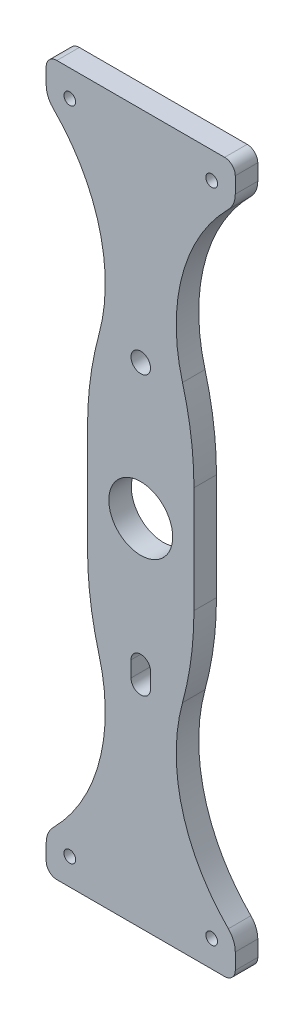
from build123d import *

# Parameters (mm, degrees)
SKETCH1_R           = 9
SKETCH1_R_2         = 2.75
SKETCH1_R_3         = 1.65
BOSS_EXTRUDE1_DEPTH = 6.35


with BuildPart() as part:
    # Sketch1 → Boss-Extrude1 (new body)
    with BuildSketch(Plane.XY):
        with BuildLine():
            Line((-15, 15), (-15, -15))
            ThreePointArc((-15, -15), (-14.189358833, -27.149936386), (-11.771805737, -39.084488338))
            ThreePointArc((-11.771805737, -39.084488338), (-11.680110458, -65.181584812), (-24.702260095, -87.797739905))
            ThreePointArc((-24.702260095, -87.797739905), (-26.143798891, -89.955155175), (-26.65, -92.5))
            Line((-26.65, -92.5), (-26.65, -97))
            ThreePointArc((-26.65, -97), (-25.771320344, -99.121320344), (-23.65, -100))
            Line((-23.65, -100), (23.65, -100))
            ThreePointArc((23.65, -100), (25.771320344, -99.121320344), (26.65, -97))
            Line((26.65, -97), (26.65, -92.5))
            ThreePointArc((26.65, -92.5), (26.143798891, -89.955155175), (24.702260095, -87.797739905))
            ThreePointArc((24.702260095, -87.797739905), (11.680110458, -65.181584812), (11.771805737, -39.084488338))
            ThreePointArc((11.771805737, -39.084488338), (14.189358833, -27.149936386), (15, -15))
            Line((15, -15), (15, 15))
            ThreePointArc((15, 15), (14.189358833, 27.149936386), (11.771805737, 39.084488338))
            ThreePointArc((11.771805737, 39.084488338), (11.680110458, 65.181584812), (24.702260095, 87.797739905))
            ThreePointArc((24.702260095, 87.797739905), (26.143798891, 89.955155175), (26.65, 92.5))
            Line((26.65, 92.5), (26.65, 97))
            ThreePointArc((26.65, 97), (25.771320344, 99.121320344), (23.65, 100))
            Line((23.65, 100), (-23.65, 100))
            ThreePointArc((-23.65, 100), (-25.771320344, 99.121320344), (-26.65, 97))
            Line((-26.65, 97), (-26.65, 92.5))
            ThreePointArc((-26.65, 92.5), (-26.143798891, 89.955155175), (-24.702260095, 87.797739905))
            ThreePointArc((-24.702260095, 87.797739905), (-11.680110458, 65.181584812), (-11.771805737, 39.084488338))
            ThreePointArc((-11.771805737, 39.084488338), (-14.189358833, 27.149936386), (-15, 15))
        make_face()
        Circle(SKETCH1_R, mode=Mode.SUBTRACT)
        with Locations((0, 38.1)):
            Circle(SKETCH1_R_2, mode=Mode.SUBTRACT)
        with Locations((20, 92.5)):
            Circle(SKETCH1_R_3, mode=Mode.SUBTRACT)
        with Locations((-20, 92.5)):
            Circle(SKETCH1_R_3, mode=Mode.SUBTRACT)
        with Locations((-20, -92.5)):
            Circle(SKETCH1_R_3, mode=Mode.SUBTRACT)
        with Locations((20, -92.5)):
            Circle(SKETCH1_R_3, mode=Mode.SUBTRACT)
        with BuildLine():
            Line((2.75, -35.8890625), (2.75, -40.3109375))
            ThreePointArc((2.75, -40.3109375), (0, -43.0609375), (-2.75, -40.3109375))
            Line((-2.75, -40.3109375), (-2.75, -35.8890625))
            ThreePointArc((-2.75, -35.8890625), (0, -33.1390625), (2.75, -35.8890625))
        make_face(mode=Mode.SUBTRACT)
    extrude(amount=BOSS_EXTRUDE1_DEPTH)


solid = part.part
